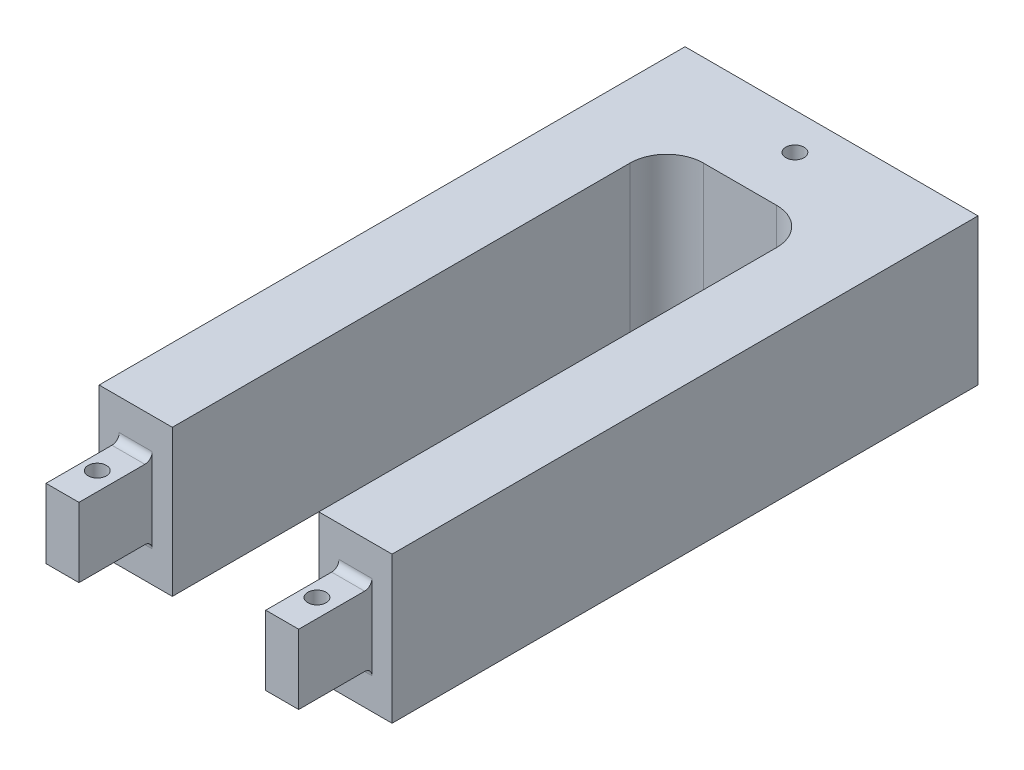
from build123d import *

# Parameters (mm, degrees)
BOSS_EXTRUDE1_DEPTH = 50.8
SKETCH2_W           = 11.43
SKETCH2_H           = 24.13
BOSS_EXTRUDE2_DEPTH = 25.4
FILLET3_R           = 2.54
SKETCH3_R           = 3.175
CUT_EXTRUDE1_DEPTH  = 199.372898559
SKETCH4_W           = 25.146
SKETCH4_H           = 13.208
SKETCH4_W_2         = 25.908
SKETCH4_H_2         = 8.89
CUT_EXTRUDE2_DEPTH  = 25.4
CHAMFER1_SIZE       = 8.89
SKETCH5_R           = 3.175
CUT_EXTRUDE3_DEPTH  = 202.317710741
SKETCH7_W           = 50.8
SKETCH7_H           = 50.8
BOSS_EXTRUDE4_DEPTH = 6.35
FILLET4_R           = 12.7


with BuildPart() as part:
    # Sketch1 → Boss-Extrude1 (new body)
    with BuildSketch(Plane(origin=(0, 0, 0), x_dir=(1, 0, 0), z_dir=(0, 1, 0))):
        Polygon((-59.171267606, -17.601126761), (-59.171267606, 185.598873239), (42.428732394, 185.598873239), (42.428732394, -17.601126761), (17.028732394, -17.601126761), (17.028732394, 160.198873239), (-33.771267606, 160.198873239), (-33.771267606, -17.601126761), align=None)
    extrude(amount=BOSS_EXTRUDE1_DEPTH)

    # Sketch2 → Boss-Extrude2 (add)
    with BuildSketch(Plane.XY.offset(17.601126761)):
        with Locations((-46.471267606, 25.4)):
            Rectangle(SKETCH2_W, SKETCH2_H)
        with Locations((29.728732394, 25.4)):
            Rectangle(SKETCH2_W, SKETCH2_H)
    extrude(amount=BOSS_EXTRUDE2_DEPTH)

    # Fillet3
    fillet3_edges = [part.edges().sort_by_distance(p)[0] for p in [
        (-46.471267606, 37.465, 17.601126761),
        (-46.471267606, 13.335, 17.601126761),
        (29.728732394, 37.465, 17.601126761),
        (29.728732394, 13.335, 17.601126761),
    ]]
    fillet(fillet3_edges, radius=FILLET3_R)

    # Sketch3 → Cut-Extrude1 (cut, through all)
    with BuildSketch(Plane(origin=(0, 37.465, 0), x_dir=(1, 0, 0), z_dir=(0, 1, 0))):
        with Locations(Location((-47.106267606, -30.301126761, 0), (0, 0, 270))):
            Circle(SKETCH3_R)
        with Locations(Location((29.093732394, -30.301126761, 0), (0, 0, 270))):
            Circle(SKETCH3_R)
    extrude(amount=-CUT_EXTRUDE1_DEPTH, mode=Mode.SUBTRACT)

    # Sketch4 → Cut-Extrude2 (cut)
    with BuildSketch(Plane(origin=(0, 0, -185.598873239), x_dir=(-1, 0, 0), z_dir=(0, 0, -1))):
        with Locations((-17.155732394, 25.4)):
            Rectangle(SKETCH4_W, SKETCH4_H)
        with Locations((8.371267606, 25.4)):
            Rectangle(SKETCH4_W_2, SKETCH4_H)
        with Locations((8.371267606, 36.449)):
            Rectangle(SKETCH4_W_2, SKETCH4_H_2)
        with Locations((33.898267606, 25.4)):
            Rectangle(SKETCH4_W, SKETCH4_H)
        with Locations((8.371267606, 14.351)):
            Rectangle(SKETCH4_W_2, SKETCH4_H_2)
    extrude(amount=-CUT_EXTRUDE2_DEPTH, mode=Mode.SUBTRACT)

    # Chamfer1
    chamfer1_edges = [part.edges().sort_by_distance(p)[0] for p in [
        (-21.325267606, 32.004, -172.898873239),
        (-21.325267606, 18.796, -172.898873239),
        (4.582732394, 18.796, -172.898873239),
        (4.582732394, 32.004, -172.898873239),
    ]]
    chamfer(chamfer1_edges, length=CHAMFER1_SIZE - 0.0001)  # a hair under: the kernel refuses the full size

    # Sketch5 → Cut-Extrude3 (cut, through all)
    with BuildSketch(Plane.XZ):
        with Locations(Location((-8.371267606, -172.898873239, 0), (0, 0, 270))):
            Circle(SKETCH5_R)
    extrude(amount=-CUT_EXTRUDE3_DEPTH, mode=Mode.SUBTRACT)

    # Sketch7 → Boss-Extrude4 (add)
    with BuildSketch(Plane.XY.offset(-160.198873239)):
        with Locations((-8.371267606, 25.4)):
            Rectangle(SKETCH7_W, SKETCH7_H)
    extrude(amount=BOSS_EXTRUDE4_DEPTH)

    # Fillet4
    fillet4_edges = [part.edges().sort_by_distance(p)[0] for p in [
        (-33.771267606, 25.4, -153.848873239),
        (17.028732394, 25.4, -153.848873239),
    ]]
    fillet(fillet4_edges, radius=FILLET4_R)


solid = part.part
